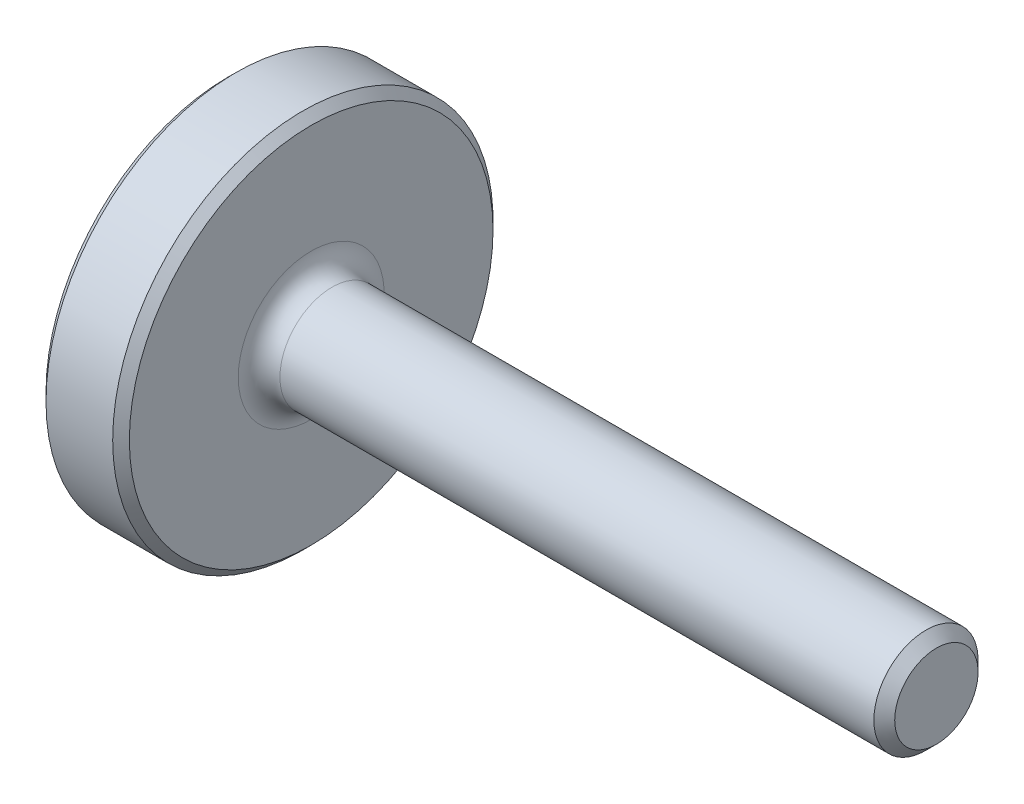
from build123d import *

# Parameters (mm, degrees)
FILLET2_R     = 2
SKETCH1_R     = 0.5
NOTHING_DEPTH = 2


with BuildPart() as part:
    # BodySke → Base-Revolve (revolve)
    with BuildSketch(Plane.XY):
        Polygon((67, 5), (68, 4), (68, 0), (0, 0), (0, 17.45), (0.8, 18.25), (7.2, 18.25), (8, 17.45), (8, 5), align=None)
    revolve(axis=Axis((-11.400788802, 0, 0), (1, 0, 0)))

    # Fillet2
    fillet2_edges = [part.edges().sort_by_distance(p)[0] for p in [
        (8, -5, 0),
    ]]
    fillet(fillet2_edges, radius=FILLET2_R)

    # Sketch1 → Nothing (add)
    with BuildSketch(Plane(origin=(68, 0, 0), x_dir=(0, 0, -1), z_dir=(1, 0, 0))):
        Circle(SKETCH1_R)
    extrude(amount=-NOTHING_DEPTH)


solid = part.part
